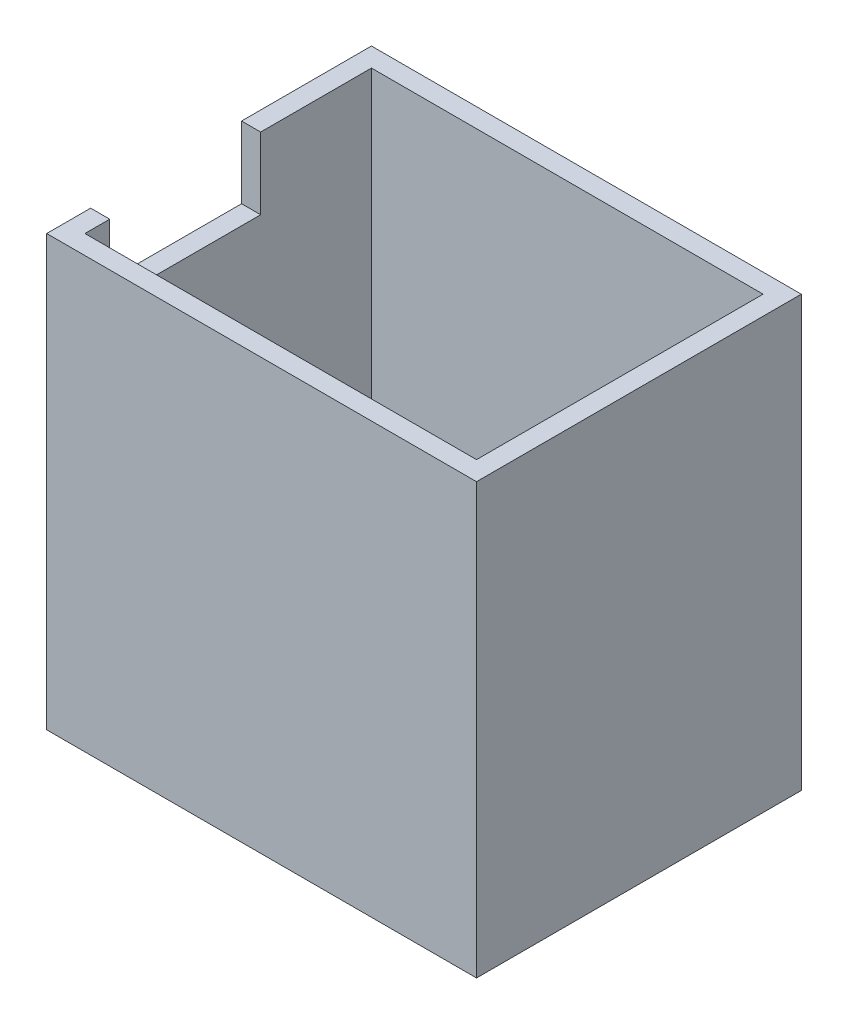
from build123d import *

# Parameters (mm, degrees)
SKETCH1_W                                      = 57.14999999999999
SKETCH1_H                                      = 43.17999999999999
BASE_DEPTH                                     = 57.15
POCKET_DEPTH                                   = 47.9552
LINACTHOLE_DEPTH                               = 68.44465304974146
ROLLMOTORHOLE_REACH                            = 85.656
DVIHOLE_REACH                                  = 69.445
CBORE_FOR_4_SOCKET_HEAD_CAP_SCREW1_D           = 3.2639
CBORE_FOR_4_SOCKET_HEAD_CAP_SCREW1_CBORE_D     = 6.35
CBORE_FOR_4_SOCKET_HEAD_CAP_SCREW1_CBORE_DEPTH = 2.8448
CBORE_FOR_8_SOCKET_HEAD_CAP_SCREW1_D           = 4.4958
CBORE_FOR_8_SOCKET_HEAD_CAP_SCREW1_CBORE_D     = 7.9375
CBORE_FOR_8_SOCKET_HEAD_CAP_SCREW1_CBORE_DEPTH = 4.1656
FILLET1_R                                      = 0.254


with BuildPart() as part:
    # Sketch1 → Base (new body)
    with BuildSketch(Plane(origin=(0, 0, 0), x_dir=(1, 0, 0), z_dir=(0, 1, 0))):
        Rectangle(SKETCH1_W, SKETCH1_H)
    extrude(amount=BASE_DEPTH)

    # Sketch2 → Pocket (cut)
    with BuildSketch(Plane(origin=(0, 57.15, 0), x_dir=(1, 0, 0), z_dir=(0, 1, 0))):
        Polygon((26.035000000000004, -19.05), (-26.03499999999999, -19.050000000000008), (-26.03499999999999, 19.049999999999994), (26.035000000000004, 19.050000000000004), align=None)
    extrude(amount=-POCKET_DEPTH, mode=Mode.SUBTRACT)

    # Sketch3 → LinActHole (cut, through all)
    with BuildSketch(Plane(origin=(0, 0, 0), x_dir=(-1, 0, 0), z_dir=(0, -1, 0))):
        Polygon((7.492999999999988, -7.7470000000000026), (-10.79500000000001, -7.747000000000003), (-10.79500000000001, 7.746999999999995), (7.492999999999988, 7.746999999999996), align=None)
    extrude(amount=-LINACTHOLE_DEPTH, mode=Mode.SUBTRACT)

    # Sketch4 → RollMotorHole (cut, up to next)
    with BuildSketch(Plane.ZY.offset(28.575), mode=Mode.PRIVATE) as rollmotorhole_sk1:
        Polygon((15.747999999999998, 57.15), (-4.317999999999999, 57.150000000000006), (-4.317999999999998, 47.625), (15.747999999999998, 47.625000000000014), align=None)
    rollmotorhole_tool1 = extrude(rollmotorhole_sk1.sketch, amount=-ROLLMOTORHOLE_REACH, mode=Mode.PRIVATE) & part.part
    add(rollmotorhole_tool1.solids().sort_by_distance((-28.575, 52.3875, 5.715))[0], mode=Mode.SUBTRACT)

    # Sketch5 → DviHole (cut, up to next)
    with BuildSketch(Plane.XZ, mode=Mode.PRIVATE) as dvihole_sk1:
        with BuildLine():
            Line((17.624947542752004, -13.715999999999998), (24.228947542752003, -13.716))
            Line((24.228947542752003, -13.716), (24.228947542752003, 13.716000000000003))
            Line((24.228947542752003, 13.716000000000003), (17.624947542752004, 13.716000000000005))
            ThreePointArc((17.624947542752004, 13.716000000000005), (15.828896318538174, 12.972051224213832), (15.084947542752005, 11.176000000000002))
            Line((15.084947542752005, 11.176000000000002), (15.084947542752005, -11.175999999999998))
            ThreePointArc((15.084947542752005, -11.175999999999998), (15.828896318538174, -12.972051224213828), (17.624947542752004, -13.715999999999998))
        make_face()
    dvihole_tool1 = extrude(dvihole_sk1.sketch, amount=-DVIHOLE_REACH, mode=Mode.PRIVATE) & part.part
    add(dvihole_tool1.solids().sort_by_distance((19.701649, 0, 0))[0], mode=Mode.SUBTRACT)

    # CBORE for #4 Socket Head Cap Screw1 (through all)
    with Locations(Plane(origin=(0, 0, 0), x_dir=(-1, 0, 0), z_dir=(0, -1, 0))):
        with Locations((-19.656947543, 16.256), (-19.656947543, -16.256)):
            CounterBoreHole(CBORE_FOR_4_SOCKET_HEAD_CAP_SCREW1_D / 2, CBORE_FOR_4_SOCKET_HEAD_CAP_SCREW1_CBORE_D / 2, CBORE_FOR_4_SOCKET_HEAD_CAP_SCREW1_CBORE_DEPTH)

    # CBORE for #8 Socket Head Cap Screw1 (through all)
    with Locations(Plane(origin=(0, 0, 0), x_dir=(-1, 0, 0), z_dir=(0, -1, 0))):
        with Locations((3.175, 14.605), (3.175, -14.605)):
            CounterBoreHole(CBORE_FOR_8_SOCKET_HEAD_CAP_SCREW1_D / 2, CBORE_FOR_8_SOCKET_HEAD_CAP_SCREW1_CBORE_D / 2, CBORE_FOR_8_SOCKET_HEAD_CAP_SCREW1_CBORE_DEPTH)

    # Fillet1
    # the kernel refuses this fillet: 0.254 mm, written as the material it takes off along each edge
    with BuildSketch(Plane(origin=(21.56194754300001, 2.8448, 13.716000000000006), x_dir=(1, 0, -5.46e-15), z_dir=(0, -1, 0))) as fillet1_piece_1:
        with BuildLine():
            CenterArc((0.6508256982823206, 0.25399999999999956), FILLET1_R, 138.18968510422349, 131.8103148957768)
            ThreePointArc((0.4615052761873327, 0.4233333333333256), (0.24121576475939824, 0.20026008045803986), (0, 0))
            Line((0, 0), (0.650825698282322, 0))
        make_face()
    extrude(amount=4.471864245705805, mode=Mode.SUBTRACT)
    with BuildSketch(Plane(origin=(17.751947542999993, 2.8448, 13.716000000000006), x_dir=(-0.9977003347705025, 0, -0.06777936263220105), z_dir=(0, -1, 0))) as fillet1_piece_2:
        with BuildLine():
            CenterArc((0.5964633639844708, -0.2525550871245977), FILLET1_R, 96.11431340709308, 122.7684855876463)
            Line((0.3987417282209075, -0.4119983521155698), (0.37896956464454973, -0.4279426786146676))
            ThreePointArc((0.37896956464454973, -0.4279426786146676), (0.19043822259418336, -0.21464439732501625), (-0.01658222975058737, -0.01924031331602186))
            Line((-0.01658222975058737, -0.01924031331602186), (0.00172159581085787, 0.02534158850317019))
            ThreePointArc((0.00172159581085787, 0.02534158850317019), (0.12842953857413036, 0.01673360943207212), (0.5667037799709318, 0.02525550871246005))
            Line((0.5667037799709318, 0.02525550871246005), (0.5694091966994345, 0))
        make_face()
    extrude(amount=4.278191101484826, mode=Mode.SUBTRACT)
    with BuildSketch(Plane(origin=(17.751947543000007, 2.8448, -13.715999999999996), x_dir=(-0.9977003347705027, 0, 0.06777936263219668), z_dir=(0, -1, 0))) as fillet1_piece_3:
        with BuildLine():
            CenterArc((0.5964633639844823, 0.25255508712459757), FILLET1_R, 141.1172010052604, 122.76848558764627)
            Line((0.3987417282209198, 0.4119983521155705), (0.37896956464456205, 0.4279426786146684))
            ThreePointArc((0.37896956464456205, 0.4279426786146684), (0.19043822259419124, 0.21464439732501767), (-0.01658222975058728, 0.01924031331602193))
            Line((-0.01658222975058728, 0.01924031331602193), (0.00172159581085776, -0.02534158850317019))
            ThreePointArc((0.00172159581085776, -0.02534158850317019), (0.12842953857414433, -0.01673360943206995), (0.5667037799709422, -0.02525550871246003))
            Line((0.5667037799709422, -0.02525550871246003), (0.5694091966994449, 0))
        make_face()
    extrude(amount=4.278191101484849, mode=Mode.SUBTRACT)
    with BuildSketch(Plane(origin=(21.561947542999995, 2.8448, -13.715999999999996), x_dir=(1, 0, -5.46e-15), z_dir=(0, -1, 0))) as fillet1_piece_4:
        with BuildLine():
            CenterArc((0.6508256982823268, -0.25399999999999956), FILLET1_R, 90.0000000000003, 131.81031489577913)
            ThreePointArc((0.46150527618734805, -0.42333333333333484), (0.2412157647594075, -0.20026008045804258), (0, 0))
            Line((0, 0), (0.6508256982823255, 0))
        make_face()
    extrude(amount=4.471864245705815, mode=Mode.SUBTRACT)


solid = part.part
